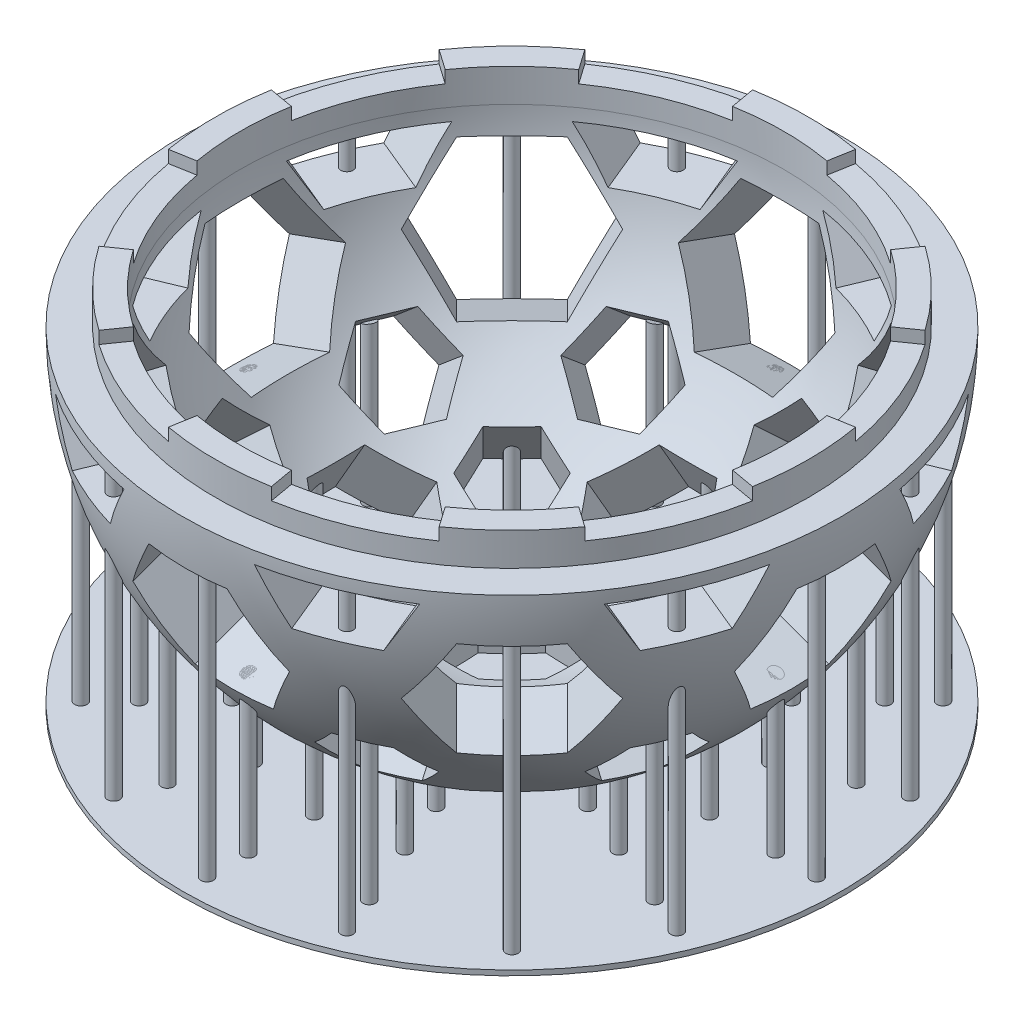
from build123d import *
from build123d.topology import SkipClean

# Parameters (mm, degrees)
CUT_EXTRUDE1_DEPTH      = 60
CIRPATTERN1_COUNT       = 8
CUT_EXTRUDE2_DEPTH      = 60
CIRPATTERN2_COUNT       = 8
CUT_EXTRUDE3_DEPTH      = 72
CIRPATTERN3_COUNT       = 8
CUT_EXTRUDE4_DEPTH      = 72
CUT_EXTRUDE5_DEPTH      = 72
CIRPATTERN4_COUNT       = 4
CUT_EXTRUDE6_REACH      = 70.927
CUT_EXTRUDE6_END_RADIUS = 40
CIRPATTERN5_COUNT       = 8
SKETCH14_R              = 40
BOSS_EXTRUDE1_DEPTH     = 0.617262
SKETCH15_R              = 0.75
BOSS_EXTRUDE8_DEPTH     = 38.8
CIRPATTERN6_COUNT       = 16
SKETCH16_R              = 0.75
BOSS_EXTRUDE13_DEPTH    = 23
CIRPATTERN10_COUNT      = 16
SKETCH17_R              = 0.75
BOSS_EXTRUDE16_DEPTH    = 12
CIRPATTERN11_COUNT      = 16
SKETCH18_R              = 0.75
BOSS_EXTRUDE17_DEPTH    = 2.5
CIRPATTERN12_COUNT      = 16
SKETCH19_R              = 0.75
BOSS_EXTRUDE19_DEPTH    = 5
CIRPATTERN13_COUNT      = 8
SKETCH20_R              = 2
CUT_EXTRUDE7_DEPTH      = 5
CIRPATTERN14_COUNT      = 16
SKETCH31_R              = 36
SKETCH31_R_2            = 33
BOSS_EXTRUDE41_DEPTH    = 2.5
BOSS_EXTRUDE42_DEPTH    = 1.5
CIRPATTERN17_COUNT      = 8


with BuildPart() as part:
    # Sketch1 → Revolve1 (revolve)
    with BuildSketch(Plane.XY):
        with BuildLine():
            Line((0, -40), (0, -33))
            ThreePointArc((0, -33), (-23.334523779, -23.334523779), (-33, 0))
            Line((-33, 0), (-40, 0))
            ThreePointArc((-40, 0), (-28.284271247, -28.284271247), (0, -40))
        make_face()
    revolve(axis=Axis((0, -40, 0), (0, 1, 0)))

    # Sketch6 → Cut-Extrude1 (cut)
    with BuildSketch(Plane(origin=(0, 0, 0), x_dir=(1, 0, 0), z_dir=(0, -0.34202014332566943, 0.9396926207859081))):
        Polygon((4.75, -8.227241336), (9.5, 0), (4.75, 8.227241336), (-4.75, 8.227241336), (-9.5, 0), (-4.75, -8.227241336), align=None)
    cut_extrude1 = extrude(amount=CUT_EXTRUDE1_DEPTH, mode=Mode.SUBTRACT)

    # CirPattern1: Cut-Extrude1 ×8 about axis
    cirpattern1_axis = Axis((0, 0, 0), (0, 1, 0))
    for i in range(1, CIRPATTERN1_COUNT):
        add(cut_extrude1.rotate(cirpattern1_axis, i * 360 / CIRPATTERN1_COUNT), mode=Mode.SUBTRACT)

    # Sketch8 → Cut-Extrude2 (cut)
    with BuildSketch(Plane(origin=(0, 0, 0), x_dir=(0.3826834323650905, -2.170357963753732e-15, 0.9238795325112865), z_dir=(0.707732781991628, 0.6427876096865428, -0.29315251683697247))):
        Polygon((-2.886751346, -5), (2.886751346, -5), (5.773502692, 0), (2.886751346, 5), (-2.886751346, 5), (-5.773502692, 0), align=None)
    cut_extrude2 = extrude(amount=-CUT_EXTRUDE2_DEPTH, mode=Mode.SUBTRACT)

    # CirPattern2: Cut-Extrude2 ×8 about axis
    cirpattern2_axis = Axis((0, 0, 0), (0, 1, 0))
    for i in range(1, CIRPATTERN2_COUNT):
        add(cut_extrude2.rotate(cirpattern2_axis, i * 360 / CIRPATTERN2_COUNT), mode=Mode.SUBTRACT)

    # Sketch9 → Cut-Extrude3 (cut)
    with BuildSketch(Plane(origin=(0, 0, 0), x_dir=(1, 0, 0), z_dir=(0, -0.8660254037844398, 0.499999999999998))):
        Polygon((3.5, -6.062177826), (7, 0), (3.5, 6.062177826), (-3.5, 6.062177826), (-7, 0), (-3.5, -6.062177826), align=None)
    cut_extrude3 = extrude(amount=CUT_EXTRUDE3_DEPTH, mode=Mode.SUBTRACT)

    # CirPattern3: Cut-Extrude3 ×8 about axis, 4 skipped
    cirpattern3_axis = Axis((0, -40, 0), (0, 1, 0))
    add([cut_extrude3.rotate(cirpattern3_axis, i * 360 / CIRPATTERN3_COUNT) for i in range(1, CIRPATTERN3_COUNT) if i not in (1, 3, 5, 7)], mode=Mode.SUBTRACT)

    # Sketch10 → Cut-Extrude4 (cut)
    with BuildSketch(Plane(origin=(0, 0, 0), x_dir=(1, 0, 0), z_dir=(0, 1, 0))):
        Polygon((2.899494937, -7), (7, -2.899494937), (7, 2.899494937), (2.899494937, 7), (-2.899494937, 7), (-7, 2.899494937), (-7, -2.899494937), (-2.899494937, -7), align=None)
    extrude(amount=-CUT_EXTRUDE4_DEPTH, mode=Mode.SUBTRACT)

    # Sketch12 → Cut-Extrude5 (cut)
    with BuildSketch(Plane(origin=(0, 0, 0), x_dir=(-0.7071067811865464, -5.787092590307399e-15, 0.7071067811865488), z_dir=(0.37470950522067953, 0.8480480961564285, 0.3747095052206852))):
        Polygon((-5, 0), (-2.5, -4.330127019), (2.5, -4.330127019), (5, 0), (2.5, 4.330127019), (-2.5, 4.330127019), align=None)
    cut_extrude5 = extrude(amount=-CUT_EXTRUDE5_DEPTH, mode=Mode.SUBTRACT)

    # CirPattern4: Cut-Extrude5 ×4 about axis
    cirpattern4_axis = Axis((0, 0, 0), (0, 1, 0))
    for i in range(1, CIRPATTERN4_COUNT):
        add(cut_extrude5.rotate(cirpattern4_axis, i * 360 / CIRPATTERN4_COUNT), mode=Mode.SUBTRACT)

    # Cut-Extrude6: up to this sphere (the profile starts inside it)
    cut_extrude6_end = Location((0, 0, 0)) * Sphere(CUT_EXTRUDE6_END_RADIUS, mode=Mode.PRIVATE)
    # Sketch13 → Cut-Extrude6 (cut, up to the surface)
    with BuildSketch(Plane(origin=(0, 0, 0), x_dir=(0, 1, 0), z_dir=(0.3826834323650906, 1.3126994607605214e-15, 0.9238795325112865)), mode=Mode.PRIVATE) as cut_extrude6_sk1:
        Polygon((-1.5, 7.679714999), (-1.5, -7.679714999), (-7.400828283, -4.272870201), (-7.400828283, 4.272870201), align=None)
    cut_extrude6_tool1 = extrude(cut_extrude6_sk1.sketch, amount=-CUT_EXTRUDE6_REACH, mode=Mode.PRIVATE) & cut_extrude6_end
    cut_extrude6 = cut_extrude6_tool1.solids().sort_by_distance((0, -4.170095, 0))[0]
    add(cut_extrude6, mode=Mode.SUBTRACT)

    # CirPattern5: Cut-Extrude6 ×8 about axis
    cirpattern5_axis = Axis((0, 0, 0), (0, 1, 0))
    for i in range(1, CIRPATTERN5_COUNT):
        add(cut_extrude6.rotate(cirpattern5_axis, i * 360 / CIRPATTERN5_COUNT), mode=Mode.SUBTRACT)

    # Sketch31 → Boss-Extrude41 (add)
    with BuildSketch(Plane(origin=(0, 0, 0), x_dir=(1, 0, 0), z_dir=(0, 1, 0))):
        Circle(SKETCH31_R)
        Circle(SKETCH31_R_2, mode=Mode.SUBTRACT)
    extrude(amount=BOSS_EXTRUDE41_DEPTH)

    # Sketch32 → Boss-Extrude42 (add)
    with SkipClean():  # the faces are left unmerged after this step: merging them gives an invalid solid
        with BuildSketch(Plane(origin=(0, 2.5, 0), x_dir=(1, 0, 0), z_dir=(0, 1, 0))):
            with BuildLine():
                Line((-32.498655849, 5.730389863), (-35.453079108, 6.251334396))
                ThreePointArc((-35.453079108, 6.251334396), (-36, 0), (-35.453079108, -6.251334396))
                Line((-35.453079108, -6.251334396), (-32.498655849, -5.730389863))
                ThreePointArc((-32.498655849, -5.730389863), (-33, 0), (-32.498655849, 5.730389863))
            make_face()
        boss_extrude42 = extrude(amount=BOSS_EXTRUDE42_DEPTH)

    # CirPattern17: Boss-Extrude42 ×8 about axis
    with SkipClean():  # the faces are left unmerged after this step: merging them gives an invalid solid
        cirpattern17_axis = Axis((0, 0, 0), (0, 1, 0))
        for i in range(1, CIRPATTERN17_COUNT):
            add(boss_extrude42.rotate(cirpattern17_axis, i * 360 / CIRPATTERN17_COUNT))


with BuildPart() as body_2:
    # Sketch14 → Boss-Extrude1 (new body)
    with BuildSketch(Plane(origin=(0, -40, 0), x_dir=(1, 0, 0), z_dir=(0, 1, 0))):
        with Locations(Location((0, 0, 0), (0, 0, 270))):
            Circle(SKETCH14_R)
    extrude(amount=BOSS_EXTRUDE1_DEPTH)

    # Sketch15 → Boss-Extrude8 (add)
    with BuildSketch(Plane(origin=(0, -39.382738, 0), x_dir=(1, 0, 0), z_dir=(0, 1, 0))):
        with Locations(Location((37, 0, 0), (0, 0, 270))):
            Circle(SKETCH15_R)
    boss_extrude8 = extrude(amount=BOSS_EXTRUDE8_DEPTH)

    # CirPattern6: Boss-Extrude8 ×16 about axis
    cirpattern6_axis = Axis((0, 0, 0), (0, 1, 0))
    for i in range(1, CIRPATTERN6_COUNT):
        add(boss_extrude8.rotate(cirpattern6_axis, i * 360 / CIRPATTERN6_COUNT))

    # Sketch16 → Boss-Extrude13 (add)
    with BuildSketch(Plane(origin=(0, -39.382738, 0), x_dir=(1, 0, 0), z_dir=(0, 1, 0))):
        with Locations(Location((-32, 0, 0), (0, 0, 270))):
            Circle(SKETCH16_R)
    boss_extrude13 = extrude(amount=BOSS_EXTRUDE13_DEPTH)

    # CirPattern10: Boss-Extrude13 ×16 about axis
    cirpattern10_axis = Axis((0, 0, 0), (0, 1, 0))
    for i in range(1, CIRPATTERN10_COUNT):
        add(boss_extrude13.rotate(cirpattern10_axis, i * 360 / CIRPATTERN10_COUNT))

    # Sketch17 → Boss-Extrude16 (add)
    with BuildSketch(Plane(origin=(0, -39.382738, 0), x_dir=(1, 0, 0), z_dir=(0, 1, 0))):
        with Locations(Location((0, 24, 0), (0, 0, 270))):
            Circle(SKETCH17_R)
    boss_extrude16 = extrude(amount=BOSS_EXTRUDE16_DEPTH)

    # CirPattern11: Boss-Extrude16 ×16 about axis
    cirpattern11_axis = Axis((0, 0, 0), (0, 1, 0))
    for i in range(1, CIRPATTERN11_COUNT):
        add(boss_extrude16.rotate(cirpattern11_axis, i * 360 / CIRPATTERN11_COUNT))

    # Sketch18 → Boss-Extrude17 (add)
    with BuildSketch(Plane(origin=(0, -39.382738, 0), x_dir=(1, 0, 0), z_dir=(0, 1, 0))):
        with Locations(Location((13, 0, 0), (0, 0, 270))):
            Circle(SKETCH18_R)
    boss_extrude17 = extrude(amount=BOSS_EXTRUDE17_DEPTH)

    # CirPattern12: Boss-Extrude17 ×16 about axis
    cirpattern12_axis = Axis((0, 0, 0), (0, 1, 0))
    for i in range(1, CIRPATTERN12_COUNT):
        add(boss_extrude17.rotate(cirpattern12_axis, i * 360 / CIRPATTERN12_COUNT))

    # Sketch19 → Boss-Extrude19 (add)
    with BuildSketch(Plane(origin=(0, -39.382738, 0), x_dir=(1, 0, 0), z_dir=(0, 1, 0))):
        with Locations(Location((15.705952053, -6.50561835, 0), (0, 0, 270))):
            Circle(SKETCH19_R)
    boss_extrude19 = extrude(amount=BOSS_EXTRUDE19_DEPTH)

    # CirPattern13: Boss-Extrude19 ×8 about axis
    cirpattern13_axis = Axis((0, 0, 0), (0, 1, 0))
    for i in range(1, CIRPATTERN13_COUNT):
        add(boss_extrude19.rotate(cirpattern13_axis, i * 360 / CIRPATTERN13_COUNT))

    # Sketch20 → Cut-Extrude7 (cut)
    with BuildSketch(Plane(origin=(-1.989715228, -7.731077973, -1.989715228), x_dir=(0.9703149544244623, -0.23421234290964532, -0.06027825187435909), z_dir=(0.24184476264797208, 0.9396926207859089, 0.24184476264797644))):
        with Locations((24.98918192, -27.118096928)):
            Circle(SKETCH20_R)
    cut_extrude7 = extrude(amount=CUT_EXTRUDE7_DEPTH, mode=Mode.SUBTRACT)

    # CirPattern14: Cut-Extrude7 ×16 about axis
    cirpattern14_axis = Axis((0, 0, 0), (0, 1, 0))
    for i in range(1, CIRPATTERN14_COUNT):
        add(cut_extrude7.rotate(cirpattern14_axis, i * 360 / CIRPATTERN14_COUNT), mode=Mode.SUBTRACT)


solid = Compound([part.part, body_2.part])
